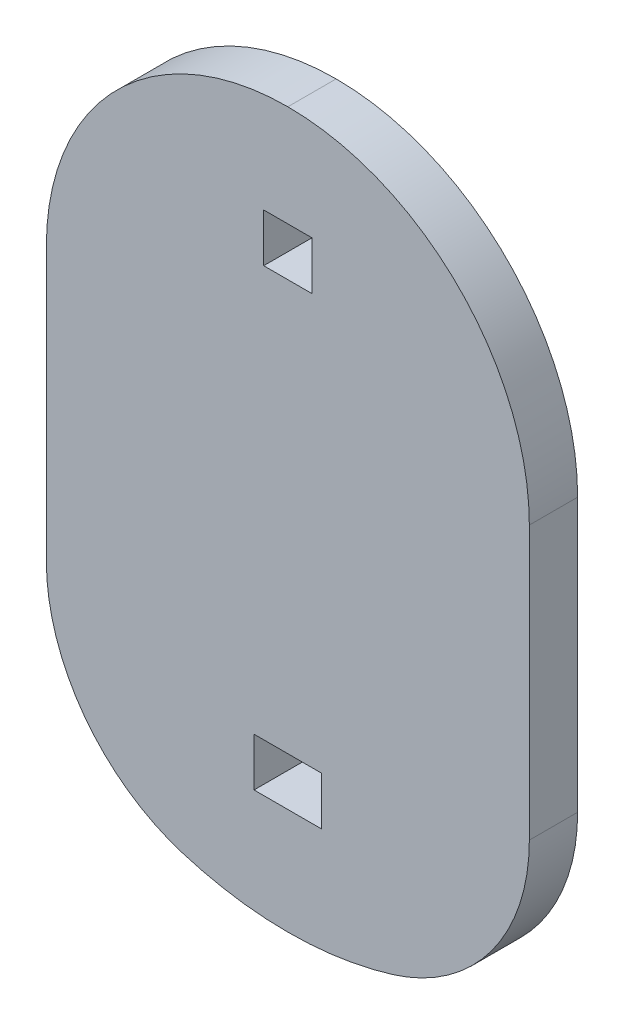
from build123d import *

# Parameters (mm, degrees)
SKETCH1_R           = 37
BOSS_EXTRUDE1_DEPTH = 5
CUT_EXTRUDE3_START  = -10
CUT_EXTRUDE3_DEPTH  = 10
FILLET2_R           = 25
FILLET3_R           = 20
SKETCH7_W           = 5
SKETCH7_H           = 5
SKETCH7_W_2         = 7
CUT_EXTRUDE4_DEPTH  = 10


with BuildPart() as part:
    # Sketch1 → Boss-Extrude1 (new body)
    with BuildSketch(Plane.XY):
        Circle(SKETCH1_R)
    extrude(amount=BOSS_EXTRUDE1_DEPTH)

    # Sketch6 → Cut-Extrude3 (cut)
    with BuildSketch(Plane.XY.offset(5).offset(CUT_EXTRUDE3_START)):
        with BuildLine():
            Line((-25, 27.276363394), (-25, -27.276363394))
            ThreePointArc((-25, -27.276363394), (-37, 0), (-25, 27.276363394))
        make_face()
        with BuildLine():
            Line((25, -27.276363394), (25, 27.276363394))
            ThreePointArc((25, 27.276363394), (37, 0), (25, -27.276363394))
        make_face()
    extrude(amount=CUT_EXTRUDE3_DEPTH, mode=Mode.SUBTRACT)

    # Fillet2
    fillet2_edges = [part.edges().sort_by_distance(p)[0] for p in [
        (-25, 27.276363394, 2.5),
        (25, 27.276363394, 2.5),
    ]]
    fillet(fillet2_edges, radius=FILLET2_R - 0.0001)  # a hair under: the kernel refuses the full size

    # Fillet3
    fillet3_edges = [part.edges().sort_by_distance(p)[0] for p in [
        (-25, -27.276363394, 2.5),
        (25, -27.276363394, 2.5),
    ]]
    fillet(fillet3_edges, radius=FILLET3_R)

    # Sketch7 → Cut-Extrude4 (cut)
    with BuildSketch(Plane.XY.offset(5)):
        with Locations((0, 24)):
            Rectangle(SKETCH7_W, SKETCH7_H)
        with Locations((0, -23.5)):
            Rectangle(SKETCH7_W_2, SKETCH7_H)
    extrude(amount=-CUT_EXTRUDE4_DEPTH, mode=Mode.SUBTRACT)


solid = part.part
